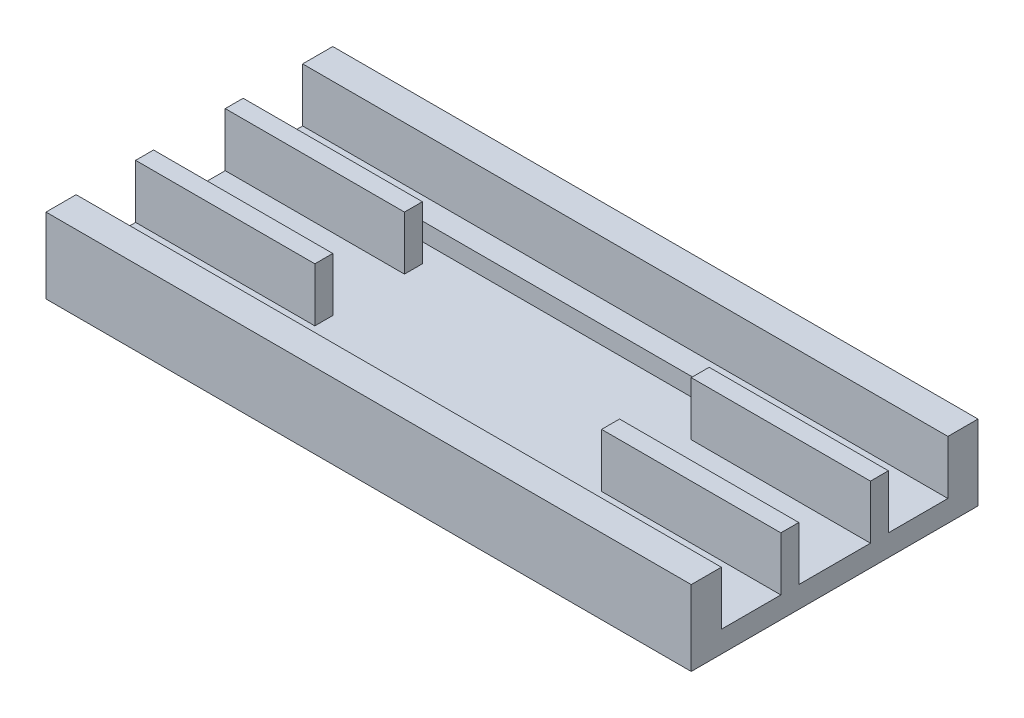
from build123d import *

# Parameters (mm, degrees)
SKETCH2_W           = 228.6
SKETCH2_H           = 101.6
BOSS_EXTRUDE1_DEPTH = 7.62
SKETCH3_W           = 228.6
SKETCH3_H           = 10.668
SKETCH3_W_2         = 63.5
SKETCH3_H_2         = 6.35
BOSS_EXTRUDE2_DEPTH = 19.05
CUT_EXTRUDE1_DEPTH  = 251.885277567


with BuildPart() as part:
    # Sketch2 → Boss-Extrude1 (new body)
    with BuildSketch(Plane(origin=(0, 0, 0), x_dir=(1, 0, 0), z_dir=(0, 1, 0))):
        with Locations((114.3, 50.8)):
            Rectangle(SKETCH2_W, SKETCH2_H)
    extrude(amount=BOSS_EXTRUDE1_DEPTH)

    # Sketch3 → Boss-Extrude2 (add)
    with BuildSketch(Plane(origin=(0, 7.62, 0), x_dir=(1, 0, 0), z_dir=(0, 1, 0))):
        with Locations((114.3, 5.334)):
            Rectangle(SKETCH3_W, SKETCH3_H)
        with Locations((31.75, 34.925)):
            Rectangle(SKETCH3_W_2, SKETCH3_H_2)
        with Locations((196.85, 34.925)):
            Rectangle(SKETCH3_W_2, SKETCH3_H_2)
        with Locations((196.85, 66.675)):
            Rectangle(SKETCH3_W_2, SKETCH3_H_2)
        with Locations((31.75, 66.675)):
            Rectangle(SKETCH3_W_2, SKETCH3_H_2)
        with Locations((114.3, 96.266)):
            Rectangle(SKETCH3_W, SKETCH3_H)
    extrude(amount=BOSS_EXTRUDE2_DEPTH)

    # Sketch4 → Cut-Extrude1 (cut, through all)
    with BuildSketch(Plane(origin=(0, 7.62, 0), x_dir=(1, 0, 0), z_dir=(0, 1, 0))):
        with BuildLine():
            Line((25.4, 24.973599875), (203.2, 24.973599875))
            ThreePointArc((203.2, 24.973599875), (206.375, 21.798599875), (203.2, 18.623599875))
            Line((203.2, 18.623599875), (25.4, 18.623599875))
            ThreePointArc((25.4, 18.623599875), (22.225, 21.798599875), (25.4, 24.973599875))
        make_face()
        with BuildLine():
            Line((25.4, 76.626400125), (203.2, 76.626400125))
            ThreePointArc((203.2, 76.626400125), (206.375, 79.801400125), (203.2, 82.976400125))
            Line((203.2, 82.976400125), (25.4, 82.976400125))
            ThreePointArc((25.4, 82.976400125), (22.225, 79.801400125), (25.4, 76.626400125))
        make_face()
    extrude(amount=-CUT_EXTRUDE1_DEPTH, mode=Mode.SUBTRACT)


solid = part.part
